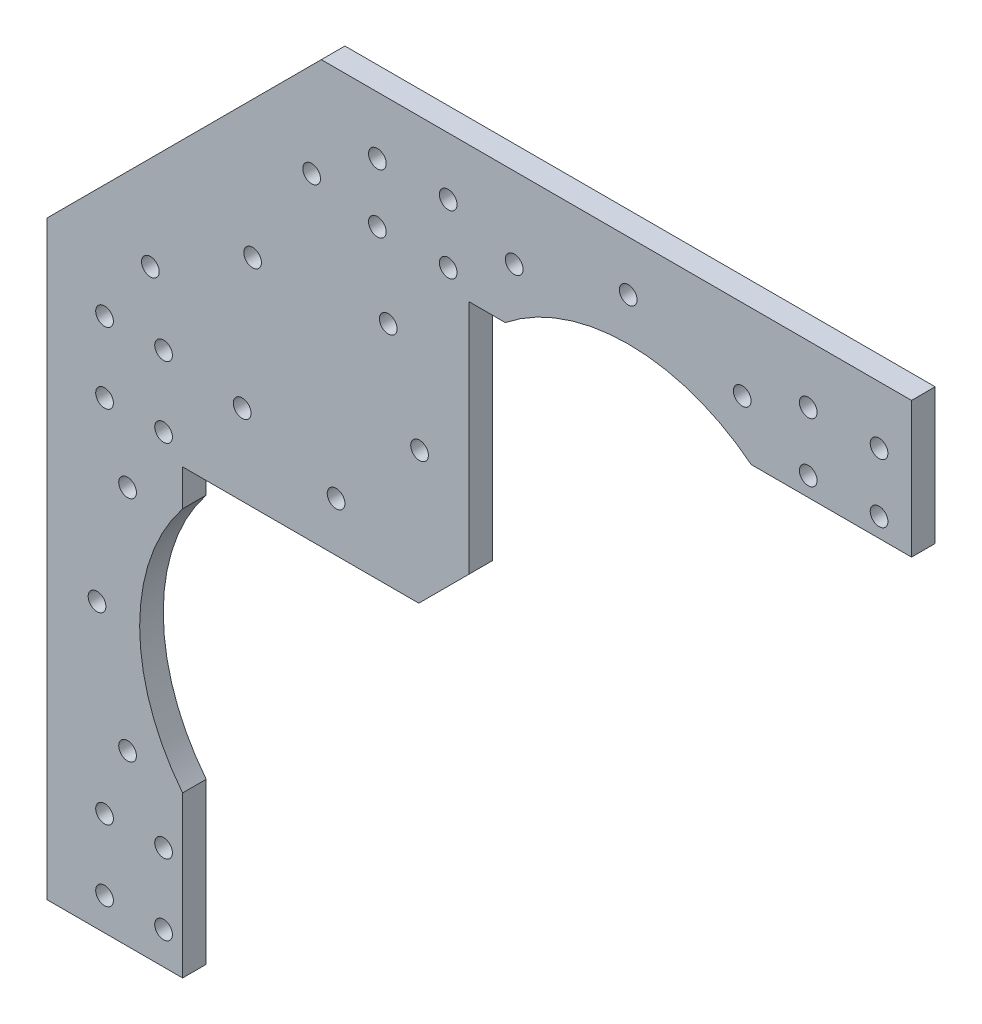
from build123d import *

# Parameters (mm, degrees)
BOSS_EXTRUDE1_DEPTH = 4
SKETCH3_R           = 1.5
CUT_EXTRUDE1_DEPTH  = 10
SKETCH4_R           = 1.5
CUT_EXTRUDE2_DEPTH  = 140.357454053


with BuildPart() as part:
    # Sketch1 → Boss-Extrude1 (new body)
    with BuildSketch(Plane.XY):
        with BuildLine():
            Line((-98.5, -48), (-75.5, -48))
            Line((-75.5, -48), (-75.5, -20.842541205))
            ThreePointArc((-75.5, -20.842541205), (-82.779120716, 0), (-75.5, 20.842541205))
            Line((-75.5, 20.842541205), (-75.5, 27))
            Line((-75.5, 27), (-35.485281374, 27))
            Line((-35.485281374, 27), (-27, 35.485281374))
            Line((-27, 35.485281374), (-27, 75.5))
            Line((-27, 75.5), (-20.842541205, 75.5))
            ThreePointArc((-20.842541205, 75.5), (0, 82.779120716), (20.842541205, 75.5))
            Line((20.842541205, 75.5), (48, 75.5))
            Line((48, 75.5), (48, 98.5))
            Line((48, 98.5), (-52, 98.5))
            Line((-52, 98.5), (-98.5, 52))
            Line((-98.5, 52), (-98.5, -48))
        make_face()
    extrude(amount=BOSS_EXTRUDE1_DEPTH)

    # Sketch3 → Cut-Extrude1 (cut)
    with BuildSketch(Plane.XY.offset(4)):
        with Locations((30.5, 78.72592343)):
            Circle(SKETCH3_R)
        with Locations((30.5, 88.72592343)):
            Circle(SKETCH3_R)
        with Locations((42.5, 88.72592343)):
            Circle(SKETCH3_R)
        with Locations((42.5, 78.72592343)):
            Circle(SKETCH3_R)
        with Locations((-42.5, 78.72592343)):
            Circle(SKETCH3_R)
        with Locations((-42.5, 88.72592343)):
            Circle(SKETCH3_R)
        with Locations((-30.5, 88.72592343)):
            Circle(SKETCH3_R)
        with Locations((-30.5, 78.72592343)):
            Circle(SKETCH3_R)
        with Locations((-88.72592343, 30.5)):
            Circle(SKETCH3_R)
        with Locations((-88.72592343, 42.5)):
            Circle(SKETCH3_R)
        with Locations((-78.72592343, 42.5)):
            Circle(SKETCH3_R)
        with Locations((-78.72592343, 30.5)):
            Circle(SKETCH3_R)
        with Locations((-88.72592343, -42.5)):
            Circle(SKETCH3_R)
        with Locations((-88.72592343, -30.5)):
            Circle(SKETCH3_R)
        with Locations((-78.72592343, -30.5)):
            Circle(SKETCH3_R)
        with Locations((-78.72592343, -42.5)):
            Circle(SKETCH3_R)
    extrude(amount=-CUT_EXTRUDE1_DEPTH, mode=Mode.SUBTRACT)

    # Sketch4 → Cut-Extrude2 (cut, through all)
    with BuildSketch(Plane.XY.offset(4)):
        with Locations((-90, 0)):
            Circle(SKETCH4_R)
        with Locations((-63.639610307, 63.639610307)):
            Circle(SKETCH4_R)
        with Locations((0, 90)):
            Circle(SKETCH4_R)
        with Locations((-80.960118382, 53.639610307)):
            Circle(SKETCH4_R)
        with Locations((-53.639610307, 80.960118382)):
            Circle(SKETCH4_R)
        with Locations((19.318516526, 84.823619098)):
            Circle(SKETCH4_R)
        with Locations((-19.318516526, 84.823619098)):
            Circle(SKETCH4_R)
        with Locations((-84.823619098, 19.318516526)):
            Circle(SKETCH4_R)
        with Locations((-84.823619098, -19.318516526)):
            Circle(SKETCH4_R)
        with Locations((-40.658639918, 65.40737726)):
            Circle(SKETCH4_R)
        with Locations((-65.40737726, 40.658639918)):
            Circle(SKETCH4_R)
        with Locations((-49.497474683, 35.355339059)):
            Circle(SKETCH4_R)
        with Locations((-35.355339059, 49.497474683)):
            Circle(SKETCH4_R)
    extrude(amount=-CUT_EXTRUDE2_DEPTH, mode=Mode.SUBTRACT)


solid = part.part
